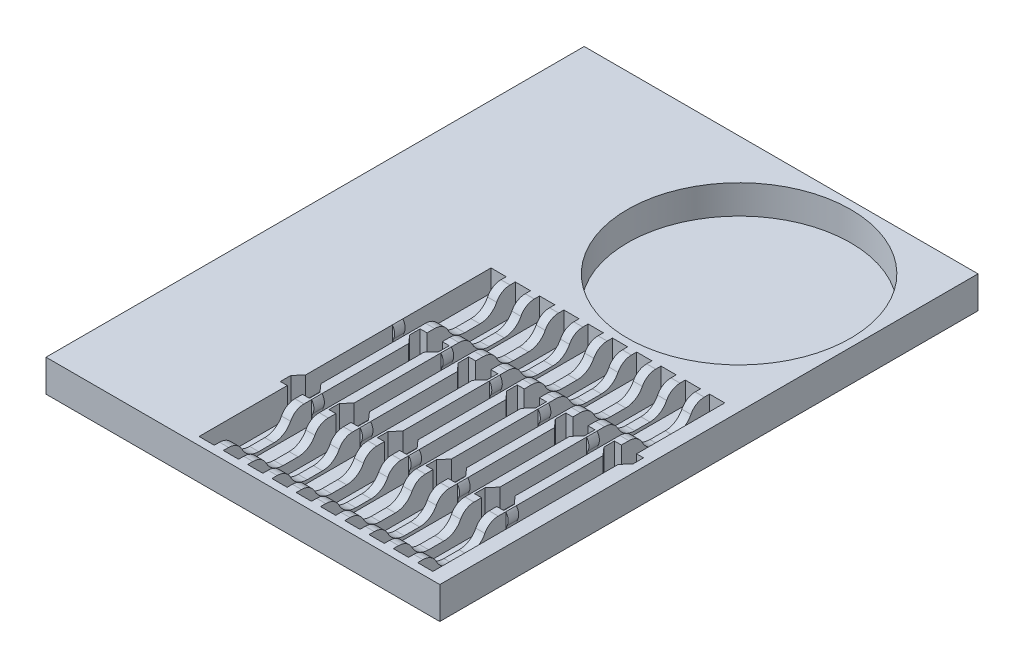
from build123d import *

# Parameters (mm, degrees)
SKETCH1_W           = 150
SKETCH1_H           = 205
BOSS_EXTRUDE1_DEPTH = 1.2
BOSS_EXTRUDE2_START = 1.2
SKETCH1_3_W         = 150
SKETCH1_3_H         = 205
SKETCH1_3_R         = 42.5
BOSS_EXTRUDE2_DEPTH = 11
BOSS_EXTRUDE3_START = 1.2
SKETCH1_5_W         = 5.8
SKETCH1_5_H         = 70.6
BOSS_EXTRUDE3_DEPTH = 2.7
CUT_EXTRUDE1_START  = -88.9
CUT_EXTRUDE1_DEPTH  = 77.45
BOSS_EXTRUDE5_DEPTH = 4
BOSS_EXTRUDE6_DEPTH = 4


# Read off the part's stored shape, not the designer's step: Cut-Extrude1
with BuildPart() as part:
    # Sketch1 → Boss-Extrude1 (new body)
    with BuildSketch(Plane(origin=(0, 0, 0), x_dir=(1, 0, 0), z_dir=(0, 1, 0))):
        Rectangle(SKETCH1_W, SKETCH1_H)
    extrude(amount=BOSS_EXTRUDE1_DEPTH)

    # Sketch1<3> → Boss-Extrude2 (add)
    with BuildSketch(Plane(origin=(0, 0, 0), x_dir=(1, 0, 0), z_dir=(0, 1, 0)).offset(BOSS_EXTRUDE2_START)):
        Rectangle(SKETCH1_3_W, SKETCH1_3_H)
        Polygon((-13.9, -58.9), (-11.25, -61.9), (-11.25, -65.9), (-13.9, -65.9), (-13.9, -99.5), (-19.7, -99.5), (-19.7, -65.9), (-22.35, -65.9), (-22.35, -61.9), (-19.7, -58.9), (-19.7, 11.7), (-13.9, 11.7), align=None, mode=Mode.SUBTRACT)
        Polygon((-2, -25.9), (-4.65, -28.9), (-4.65, -99.5), (-10.45, -99.5), (-10.45, -28.9), (-13.1, -25.9), (-13.1, -21.9), (-10.45, -21.9), (-10.45, 11.7), (-4.65, 11.7), (-4.65, -21.9), (-2, -21.9), align=None, mode=Mode.SUBTRACT)
        Polygon((4.6, -58.9), (7.25, -61.9), (7.25, -65.9), (4.6, -65.9), (4.6, -99.5), (-1.2, -99.5), (-1.2, -65.9), (-3.85, -65.9), (-3.85, -61.9), (-1.2, -58.9), (-1.2, 11.7), (4.6, 11.7), align=None, mode=Mode.SUBTRACT)
        Polygon((16.5, -25.9), (13.85, -28.9), (13.85, -99.5), (8.05, -99.5), (8.05, -28.9), (5.4, -25.9), (5.4, -21.9), (8.05, -21.9), (8.05, 11.7), (13.85, 11.7), (13.85, -21.9), (16.5, -21.9), align=None, mode=Mode.SUBTRACT)
        Polygon((23.1, -58.9), (25.75, -61.9), (25.75, -65.9), (23.1, -65.9), (23.1, -99.5), (17.3, -99.5), (17.3, -65.9), (14.65, -65.9), (14.65, -61.9), (17.3, -58.9), (17.3, 11.7), (23.1, 11.7), align=None, mode=Mode.SUBTRACT)
        Polygon((35, -25.9), (32.35, -28.9), (32.35, -99.5), (26.55, -99.5), (26.55, -28.9), (23.9, -25.9), (23.9, -21.9), (26.55, -21.9), (26.55, 11.7), (32.35, 11.7), (32.35, -21.9), (35, -21.9), align=None, mode=Mode.SUBTRACT)
        Polygon((41.6, -58.9), (44.25, -61.9), (44.25, -65.9), (41.6, -65.9), (41.6, -99.5), (35.8, -99.5), (35.8, -65.9), (33.15, -65.9), (33.15, -61.9), (35.8, -58.9), (35.8, 11.7), (41.6, 11.7), align=None, mode=Mode.SUBTRACT)
        Polygon((53.5, -25.9), (50.85, -28.9), (50.85, -99.5), (45.05, -99.5), (45.05, -28.9), (42.4, -25.9), (42.4, -21.9), (45.05, -21.9), (45.05, 11.7), (50.85, 11.7), (50.85, -21.9), (53.5, -21.9), align=None, mode=Mode.SUBTRACT)
        Polygon((60.1, -58.9), (62.75, -61.9), (62.75, -65.9), (60.1, -65.9), (60.1, -99.5), (54.3, -99.5), (54.3, -65.9), (51.65, -65.9), (51.65, -61.9), (54.3, -58.9), (54.3, 11.7), (60.1, 11.7), align=None, mode=Mode.SUBTRACT)
        Polygon((72, -25.9), (69.35, -28.9), (69.35, -99.5), (63.55, -99.5), (63.55, -28.9), (60.9, -25.9), (60.9, -21.9), (63.55, -21.9), (63.55, 11.7), (69.35, 11.7), (69.35, -21.9), (72, -21.9), align=None, mode=Mode.SUBTRACT)
        with Locations(Location((29.5, 57, 0), (0, 0, 90))):
            Circle(SKETCH1_3_R, mode=Mode.SUBTRACT)
    extrude(amount=BOSS_EXTRUDE2_DEPTH)

    # Sketch1<5> → Boss-Extrude3 (add)
    with BuildSketch(Plane(origin=(0, 0, 0), x_dir=(1, 0, 0), z_dir=(0, 1, 0)).offset(BOSS_EXTRUDE3_START)):
        with Locations((-16.8, -23.6)):
            Rectangle(SKETCH1_5_W, SKETCH1_5_H)
        with Locations((-7.55, -64.2)):
            Rectangle(SKETCH1_5_W, SKETCH1_5_H)
        with Locations((1.7, -23.6)):
            Rectangle(SKETCH1_5_W, SKETCH1_5_H)
        with Locations((10.95, -64.2)):
            Rectangle(SKETCH1_5_W, SKETCH1_5_H)
        with Locations((20.2, -23.6)):
            Rectangle(SKETCH1_5_W, SKETCH1_5_H)
        with Locations((29.45, -64.2)):
            Rectangle(SKETCH1_5_W, SKETCH1_5_H)
        with Locations((38.7, -23.6)):
            Rectangle(SKETCH1_5_W, SKETCH1_5_H)
        with Locations((47.95, -64.2)):
            Rectangle(SKETCH1_5_W, SKETCH1_5_H)
        with Locations((57.2, -23.6)):
            Rectangle(SKETCH1_5_W, SKETCH1_5_H)
        with Locations((66.45, -64.2)):
            Rectangle(SKETCH1_5_W, SKETCH1_5_H)
    extrude(amount=BOSS_EXTRUDE3_DEPTH)

    # Cut-Extrude1 outline → Cut-Extrude1 (cut)
    with BuildSketch(Plane(origin=(75, 0, 0), x_dir=(0, 0, -1), z_dir=(1, 0, 0)).offset(CUT_EXTRUDE1_START)):
        with BuildLine():
            ThreePointArc((-73.884102323, 9.03964628), (-71.783890135, 11.345866673), (-68.783890136, 12.2))
            Line((-68.783890136, 12.2), (-97.5, 12.2))
            ThreePointArc((-97.5, 12.2), (-94.5, 11.345866673), (-92.399787812, 9.03964628))
            ThreePointArc((-92.399787812, 9.03964628), (-89.78169697, 6.164748911), (-86.041945068, 5.1))
            Line((-86.041945068, 5.1), (-80.241945068, 5.1))
            ThreePointArc((-80.241945068, 5.1), (-76.502193165, 6.164748911), (-73.884102323, 9.03964628))
        make_face()
    cut_extrude1 = extrude(amount=CUT_EXTRUDE1_DEPTH, mode=Mode.SUBTRACT)

    # Mirror1: Cut-Extrude1 across plane
    add(cut_extrude1.mirror(Plane(origin=(0, 0, 43.9), x_dir=(1, 0, 0), z_dir=(0, 0, -1))), mode=Mode.SUBTRACT)

    # Sketch4 → Boss-Extrude5 (add)
    with BuildSketch(Plane.XY.offset(65.9)):
        with BuildLine():
            Line((63.55, 3.9), (66.45, 3.9))
            ThreePointArc((66.45, 3.9), (64.158781393, 5.171603242), (64.025726497, 7.788653854))
            ThreePointArc((64.025726497, 7.788653854), (64.426049998, 10.063149988), (63.55, 12.2))
            Line((63.55, 12.2), (63.55, 3.9))
        make_face()
        with BuildLine():
            Line((69.35, 3.9), (69.35, 12.2))
            ThreePointArc((69.35, 12.2), (68.473950002, 10.063149988), (68.874273503, 7.788653854))
            ThreePointArc((68.874273503, 7.788653854), (69.080165247, 7.21010718), (69.15, 6.6))
            ThreePointArc((69.15, 6.6), (68.359188309, 4.690811691), (66.45, 3.9))
            Line((66.45, 3.9), (69.35, 3.9))
        make_face()
        with BuildLine():
            Line((45.05, 12.2), (45.05, 3.9))
            Line((45.05, 3.9), (47.95, 3.9))
            ThreePointArc((47.95, 3.9), (45.658781393, 5.171603242), (45.525726497, 7.788653854))
            ThreePointArc((45.525726497, 7.788653854), (45.926049998, 10.063149988), (45.05, 12.2))
        make_face()
        with BuildLine():
            ThreePointArc((50.65, 6.6), (49.859188309, 4.690811691), (47.95, 3.9))
            Line((47.95, 3.9), (50.85, 3.9))
            Line((50.85, 3.9), (50.85, 12.2))
            ThreePointArc((50.85, 12.2), (49.973950002, 10.063149988), (50.374273503, 7.788653854))
            ThreePointArc((50.374273503, 7.788653854), (50.580165247, 7.21010718), (50.65, 6.6))
        make_face()
        with BuildLine():
            Line((26.55, 12.2), (26.55, 3.9))
            Line((26.55, 3.9), (29.45, 3.9))
            ThreePointArc((29.45, 3.9), (27.158781393, 5.171603242), (27.025726497, 7.788653854))
            ThreePointArc((27.025726497, 7.788653854), (27.426049998, 10.063149988), (26.55, 12.2))
        make_face()
        with BuildLine():
            ThreePointArc((32.15, 6.6), (31.359188309, 4.690811691), (29.45, 3.9))
            Line((29.45, 3.9), (32.35, 3.9))
            Line((32.35, 3.9), (32.35, 12.2))
            ThreePointArc((32.35, 12.2), (31.473950002, 10.063149988), (31.874273503, 7.788653854))
            ThreePointArc((31.874273503, 7.788653854), (32.080165247, 7.21010718), (32.15, 6.6))
        make_face()
        with BuildLine():
            Line((8.05, 12.2), (8.05, 3.9))
            Line((8.05, 3.9), (10.95, 3.9))
            ThreePointArc((10.95, 3.9), (8.658781393, 5.171603242), (8.525726497, 7.788653854))
            ThreePointArc((8.525726497, 7.788653854), (8.926049998, 10.063149988), (8.05, 12.2))
        make_face()
        with BuildLine():
            ThreePointArc((13.65, 6.6), (12.859188309, 4.690811691), (10.95, 3.9))
            Line((10.95, 3.9), (13.85, 3.9))
            Line((13.85, 3.9), (13.85, 12.2))
            ThreePointArc((13.85, 12.2), (12.973950002, 10.063149988), (13.374273503, 7.788653854))
            ThreePointArc((13.374273503, 7.788653854), (13.580165247, 7.21010718), (13.65, 6.6))
        make_face()
        with BuildLine():
            Line((-10.45, 12.2), (-10.45, 3.9))
            Line((-10.45, 3.9), (-7.55, 3.9))
            ThreePointArc((-7.55, 3.9), (-9.841218607, 5.171603242), (-9.974273503, 7.788653854))
            ThreePointArc((-9.974273503, 7.788653854), (-9.573950002, 10.063149988), (-10.45, 12.2))
        make_face()
        with BuildLine():
            ThreePointArc((-4.85, 6.6), (-5.640811691, 4.690811691), (-7.55, 3.9))
            Line((-7.55, 3.9), (-4.65, 3.9))
            Line((-4.65, 3.9), (-4.65, 12.2))
            ThreePointArc((-4.65, 12.2), (-5.526049998, 10.063149988), (-5.125726497, 7.788653854))
            ThreePointArc((-5.125726497, 7.788653854), (-4.919834753, 7.21010718), (-4.85, 6.6))
        make_face()
    extrude(amount=-BOSS_EXTRUDE5_DEPTH)

    # Sketch6 → Boss-Extrude6 (add)
    with BuildSketch(Plane.XY.offset(21.9)):
        with BuildLine():
            ThreePointArc((-19.224273503, 7.788653854), (-18.823950002, 10.063149988), (-19.7, 12.2))
            Line((-19.7, 12.2), (-19.7, 3.9))
            Line((-19.7, 3.9), (-16.8, 3.9))
            ThreePointArc((-16.8, 3.9), (-19.091218607, 5.171603242), (-19.224273503, 7.788653854))
        make_face()
        with BuildLine():
            ThreePointArc((-14.1, 6.6), (-14.890811691, 4.690811691), (-16.8, 3.9))
            Line((-16.8, 3.9), (-13.9, 3.9))
            Line((-13.9, 3.9), (-13.9, 12.2))
            ThreePointArc((-13.9, 12.2), (-14.776049998, 10.063149988), (-14.375726497, 7.788653854))
            ThreePointArc((-14.375726497, 7.788653854), (-14.169834753, 7.21010718), (-14.1, 6.6))
        make_face()
        with BuildLine():
            ThreePointArc((4.4, 6.6), (3.609188305, 4.690811687), (1.699999989, 3.9))
            Line((1.699999989, 3.9), (4.6, 3.9))
            Line((4.6, 3.9), (4.6, 12.2))
            ThreePointArc((4.6, 12.2), (3.723950002, 10.063149988), (4.124273503, 7.788653854))
            ThreePointArc((4.124273503, 7.788653854), (4.330165247, 7.21010718), (4.4, 6.6))
        make_face()
        with BuildLine():
            ThreePointArc((-0.724273503, 7.788653854), (-0.323950002, 10.063149988), (-1.2, 12.2))
            Line((-1.2, 12.2), (-1.2, 3.9))
            Line((-1.2, 3.9), (1.699999989, 3.9))
            ThreePointArc((1.699999989, 3.9), (-0.591218609, 5.171603247), (-0.724273503, 7.788653854))
        make_face()
        with BuildLine():
            ThreePointArc((22.9, 6.6), (22.109188309, 4.690811691), (20.2, 3.9))
            Line((20.2, 3.9), (23.1, 3.9))
            Line((23.1, 3.9), (23.1, 12.2))
            ThreePointArc((23.1, 12.2), (22.223950002, 10.063149988), (22.624273503, 7.788653854))
            ThreePointArc((22.624273503, 7.788653854), (22.830165247, 7.21010718), (22.9, 6.6))
        make_face()
        with BuildLine():
            ThreePointArc((17.775726497, 7.788653854), (18.176049998, 10.063149988), (17.3, 12.2))
            Line((17.3, 12.2), (17.3, 3.9))
            Line((17.3, 3.9), (20.2, 3.9))
            ThreePointArc((20.2, 3.9), (17.908781393, 5.171603242), (17.775726497, 7.788653854))
        make_face()
        with BuildLine():
            ThreePointArc((41.4, 6.6), (40.609188309, 4.690811691), (38.7, 3.9))
            Line((38.7, 3.9), (41.6, 3.9))
            Line((41.6, 3.9), (41.6, 12.2))
            ThreePointArc((41.6, 12.2), (40.723950002, 10.063149988), (41.124273503, 7.788653854))
            ThreePointArc((41.124273503, 7.788653854), (41.330165247, 7.21010718), (41.4, 6.6))
        make_face()
        with BuildLine():
            ThreePointArc((36.275726497, 7.788653854), (36.676049998, 10.063149988), (35.8, 12.2))
            Line((35.8, 12.2), (35.8, 3.9))
            Line((35.8, 3.9), (38.7, 3.9))
            ThreePointArc((38.7, 3.9), (36.408781393, 5.171603242), (36.275726497, 7.788653854))
        make_face()
        with BuildLine():
            ThreePointArc((59.9, 6.6), (59.109188309, 4.690811691), (57.2, 3.9))
            Line((57.2, 3.9), (60.1, 3.9))
            Line((60.1, 3.9), (60.1, 12.2))
            ThreePointArc((60.1, 12.2), (59.223950002, 10.063149988), (59.624273503, 7.788653854))
            ThreePointArc((59.624273503, 7.788653854), (59.830165247, 7.21010718), (59.9, 6.6))
        make_face()
        with BuildLine():
            ThreePointArc((54.775726497, 7.788653854), (55.176049998, 10.063149988), (54.3, 12.2))
            Line((54.3, 12.2), (54.3, 3.9))
            Line((54.3, 3.9), (57.2, 3.9))
            ThreePointArc((57.2, 3.9), (54.908781393, 5.171603242), (54.775726497, 7.788653854))
        make_face()
    extrude(amount=BOSS_EXTRUDE6_DEPTH)


solid = part.part
